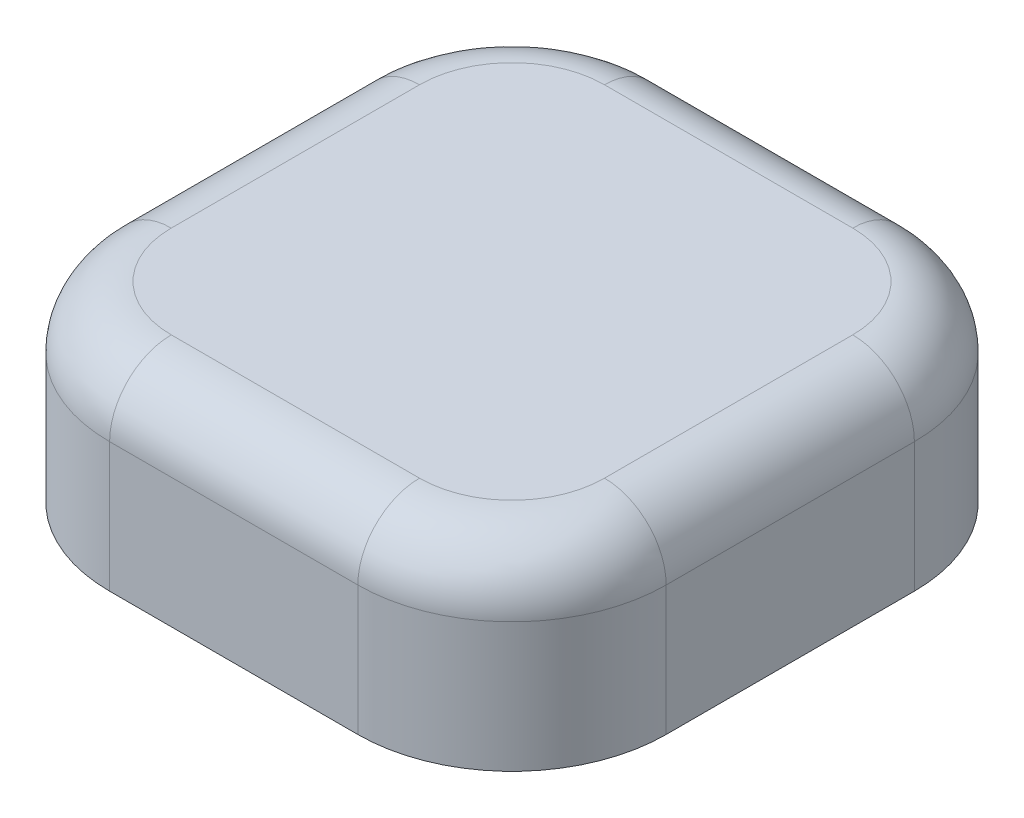
from build123d import *

# Parameters (mm, degrees)
SKETCH_1_R      = 2.8
EXTRUDE_1_DEPTH = 5
SKETCH_2_W      = 18.05
SKETCH_2_H      = 18.05
EXTRUDE_2_DEPTH = 1.2
SKETCH_3_W      = 18.05
SKETCH_3_H      = 18.05
SKETCH_3_W_2    = 15.65
SKETCH_3_H_2    = 15.65
EXTRUDE_3_DEPTH = 5
FILLET_3_R      = 5
FILLET_4_R      = 2
CHAMFER_1_SIZE  = 0.5


with BuildPart() as part:
    # 草图1 → 凸台-拉伸1 (new body)
    with BuildSketch(Plane(origin=(0, 0, 0), x_dir=(1, 0, 0), z_dir=(0, 1, 0))):
        Circle(SKETCH_1_R)
        Polygon((2.2, 0.6), (2.2, -0.6), (0.6, -0.6), (0.6, -2.2), (-0.6, -2.2), (-0.6, -0.6), (-2.2, -0.6), (-2.2, 0.6), (-0.6, 0.6), (-0.6, 2.2), (0.6, 2.2), (0.6, 0.6), align=None, mode=Mode.SUBTRACT)
    extrude(amount=-EXTRUDE_1_DEPTH)

    # 草图2 → 凸台-拉伸2 (add)
    with BuildSketch(Plane(origin=(0, 0, 0), x_dir=(1, 0, 0), z_dir=(0, 1, 0))):
        Rectangle(SKETCH_2_W, SKETCH_2_H)
    extrude(amount=EXTRUDE_2_DEPTH)

    # 草图3 → 凸台-拉伸3 (add)
    with BuildSketch(Plane(origin=(0, 0, 0), x_dir=(1, 0, 0), z_dir=(0, 1, 0))):
        Rectangle(SKETCH_3_W, SKETCH_3_H)
        Rectangle(SKETCH_3_W_2, SKETCH_3_H_2, mode=Mode.SUBTRACT)
    extrude(amount=-EXTRUDE_3_DEPTH)

    # 圆角3
    fillet_3_edges = [part.edges().sort_by_distance(p)[0] for p in [
        (7.825, -2.5, 7.825),
        (-7.825, -2.5, 7.825),
        (-7.825, -2.5, -7.825),
        (7.825, -2.5, -7.825),
        (-9.025, -1.9, 9.025),
        (9.025, -1.9, 9.025),
        (9.025, -1.9, -9.025),
        (-9.025, -1.9, -9.025),
    ]]
    fillet(fillet_3_edges, radius=FILLET_3_R)

    # 圆角4
    fillet_4_edges = [part.edges().sort_by_distance(p)[0] for p in [
        (-7.560533906, 1.2, -7.560533906),
        (0, 1.2, -9.025),
        (7.560533906, 1.2, -7.560533906),
        (9.025, 1.2, 0),
        (7.560533906, 1.2, 7.560533906),
        (0, 1.2, 9.025),
        (-7.560533906, 1.2, 7.560533906),
        (-9.025, 1.2, 0),
        (-7.825, 0, 0),
        (0, 0, -7.825),
        (7.825, 0, 0),
        (0, 0, 7.825),
        (-6.360533906, 0, -6.360533906),
        (6.360533906, 0, -6.360533906),
        (6.360533906, 0, 6.360533906),
        (-6.360533906, 0, 6.360533906),
    ]]
    fillet(fillet_4_edges, radius=FILLET_4_R)

    # 倒角1
    chamfer_1_edges = [part.edges().sort_by_distance(p)[0] for p in [
        (-2.8, 0, 0),
    ]]
    chamfer(chamfer_1_edges, length=CHAMFER_1_SIZE)


solid = part.part
